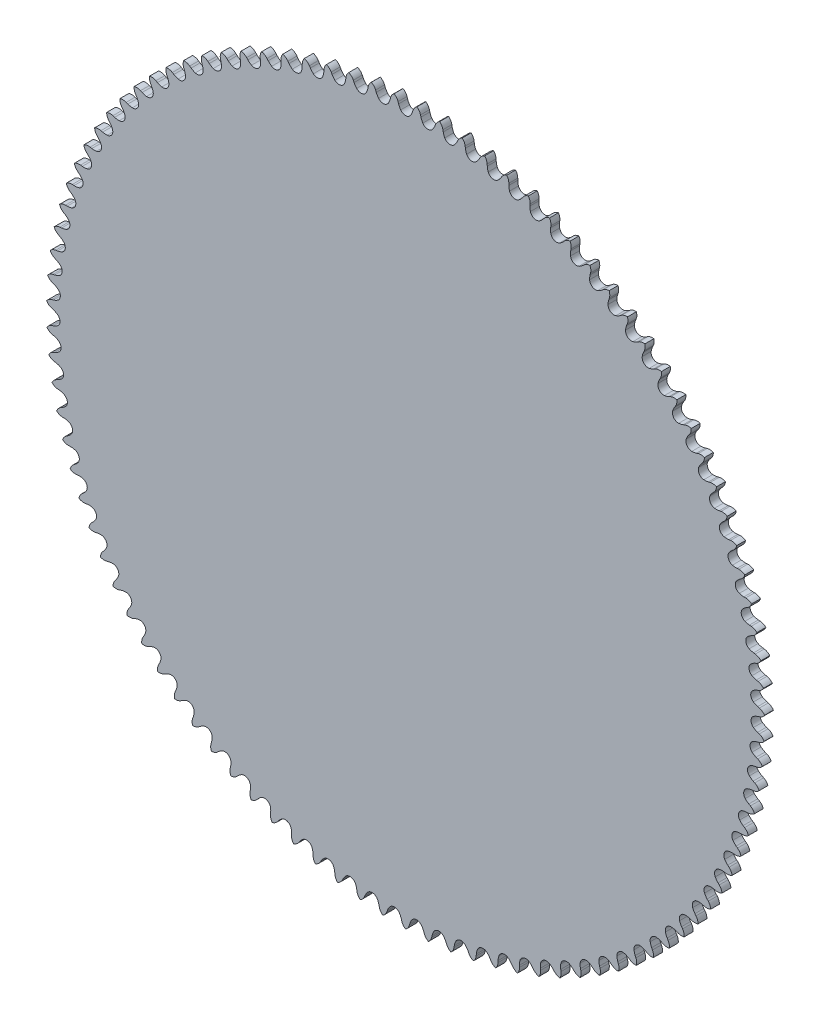
from build123d import *

# Parameters (mm, degrees)
BOSS_EXTRUDE1_DEPTH = 2.54


with BuildPart() as part:
    # Sketch1 → Boss-Extrude1 (new body)
    with BuildSketch(Plane.XY):
        with BuildLine():
            ThreePointArc((-1.380016119, 99.081333816), (-1.722125671, 99.64516894), (-1.974830149, 100.254340047))
            Line((-1.974830149, 100.254340047), (-2.133929911, 100.739050993))
            ThreePointArc((-2.133929911, 100.739050993), (-2.563862198, 101.541329529), (-3.242572124, 102.147832173))
            ThreePointArc((-3.242572124, 102.147832173), (-3.881448811, 101.499504171), (-4.259631857, 100.671572891))
            Line((-4.259631857, 100.671572891), (-4.387669031, 100.177747094))
            ThreePointArc((-4.387669031, 100.177747094), (-4.601228714, 99.553774937), (-4.906888855, 98.969377067))
            ThreePointArc((-4.906888855, 98.969377067), (-6.239150137, 98.174139078), (-7.661364256, 98.794325004))
            ThreePointArc((-7.661364256, 98.794325004), (-8.038545664, 99.335327016), (-8.329377385, 99.927244157))
            Line((-8.329377385, 99.927244157), (-8.518899096, 100.400888492))
            ThreePointArc((-8.518899096, 100.400888492), (-8.99884944, 101.174283791), (-9.714659678, 101.736518905))
            ThreePointArc((-9.714659678, 101.736518905), (-10.311130597, 101.048976133), (-10.636041591, 100.198725896))
            Line((-10.636041591, 100.198725896), (-10.732500617, 99.697773711))
            ThreePointArc((-10.732500617, 99.697773711), (-10.906055575, 99.061513019), (-11.17403552, 98.458905567))
            ThreePointArc((-11.17403552, 98.458905567), (-12.453177418, 97.580771417), (-13.911862782, 98.109506314))
            ThreePointArc((-13.911862782, 98.109506314), (-14.32259727, 98.625496791), (-14.650385159, 99.197776523))
            Line((-14.650385159, 99.197776523), (-14.869565681, 99.65844705))
            ThreePointArc((-14.869565681, 99.65844705), (-15.397601491, 100.399844921), (-16.147629726, 100.915548583))
            ThreePointArc((-16.147629726, 100.915548583), (-16.699293099, 100.191559534), (-16.969623739, 99.322413996))
            Line((-16.969623739, 99.322413996), (-17.034116211, 98.816352581))
            ThreePointArc((-17.034116211, 98.816352581), (-17.1669676, 98.170365352), (-17.396188288, 97.551974805))
            ThreePointArc((-17.396188288, 97.551974805), (-18.61706015, 96.59448043), (-20.106343148, 97.02963527))
            ThreePointArc((-20.106343148, 97.02963527), (-20.548976833, 97.518536499), (-20.912401002, 98.068874454))
            Line((-20.912401002, 98.068874454), (-21.160357774, 98.514716214))
            ThreePointArc((-21.160357774, 98.514716214), (-21.734352836, 99.221131311), (-22.515578969, 99.688226964))
            ThreePointArc((-22.515578969, 99.688226964), (-23.020213441, 98.930706886), (-23.234875201, 98.046165791))
            Line((-23.234875201, 98.046165791), (-23.267141431, 97.537032875))
            ThreePointArc((-23.267141431, 97.537032875), (-23.358754305, 96.883920271), (-23.548292745, 96.252236671))
            ThreePointArc((-23.548292745, 96.252236671), (-24.705978551, 95.219237562), (-26.219862366, 95.55906013))
            ThreePointArc((-26.219862366, 95.55906013), (-26.692612918, 96.01890348), (-27.090209987, 96.545083641))
            Line((-27.090209987, 96.545083641), (-27.365944574, 96.974301387))
            ThreePointArc((-27.365944574, 96.974301387), (-27.983587612, 97.642889225), (-28.792865922, 98.05949604))
            ThreePointArc((-28.792865922, 98.05949604), (-29.248439509, 97.271495198), (-29.406568022, 96.37512028))
            Line((-29.406568022, 96.37512028), (-29.406478084, 95.864965963))
            ThreePointArc((-29.406478084, 95.864965963), (-29.456483551, 95.207357839), (-29.605576538, 94.564924751))
            ThreePointArc((-29.605576538, 94.564924751), (-30.695414696, 93.460580432), (-32.227803452, 93.703702382))
            ThreePointArc((-32.227803452, 93.703702382), (-32.728767272, 94.132636225), (-33.158936258, 94.632539851))
            Line((-33.158936258, 94.632539851), (-33.461338373, 95.043405274))
            ThreePointArc((-33.461338373, 95.043405274), (-34.120142358, 95.671473686), (-34.954214166, 96.035914135))
            ThreePointArc((-34.954214166, 96.035914135), (-35.358892434, 95.220605531), (-35.459850973, 94.316006175))
            Line((-35.459850973, 94.316006175), (-35.427405229, 93.806884668))
            ThreePointArc((-35.427405229, 93.806884668), (-35.435601933, 93.147428979), (-35.543649124, 92.496833255))
            ThreePointArc((-35.543649124, 92.496833255), (-36.561251239, 91.325590531), (-38.105974548, 91.471032896))
            ThreePointArc((-38.105974548, 91.471032896), (-38.633134432, 91.867330068), (-39.094143196, 92.338944223))
            Line((-39.094143196, 92.338944223), (-39.421995174, 92.729802914))
            ThreePointArc((-39.421995174, 92.729802914), (-40.119307333, 93.314822889), (-40.974814126, 93.625629498))
            ThreePointArc((-40.974814126, 93.625629498), (-41.326967579, 92.786296092), (-41.370349618, 91.877114802))
            Line((-41.370349618, 91.877114802), (-41.305678717, 91.371076157))
            ThreePointArc((-41.305678717, 91.371076157), (-41.272033654, 90.712428299), (-41.33859998, 90.056289658))
            ThreePointArc((-41.33859998, 90.056289658), (-42.279868528, 88.82286471), (-43.830706334, 88.870041845))
            ThreePointArc((-43.830706334, 88.870041845), (-44.381939595, 89.232106596), (-44.871931817, 89.673532257))
            Line((-44.871931817, 89.673532257), (-45.223913513, 90.042810365))
            ThreePointArc((-45.223913513, 90.042810365), (-45.956926018, 90.582426236), (-46.830422972, 90.838347496))
            ThreePointArc((-46.830422972, 90.838347496), (-47.128633611, 89.978368988), (-47.114264467, 89.068266715))
            Line((-47.114264467, 89.068266715), (-47.017628815, 88.567348572))
            ThreePointArc((-47.017628815, 88.567348572), (-46.942277462, 87.912160686), (-46.967094884, 87.253121168))
            ThreePointArc((-46.967094884, 87.253121168), (-47.828239709, 85.962480562), (-49.378947336, 85.911202502))
            ThreePointArc((-49.378947336, 85.911202502), (-49.952034351, 86.237576926), (-50.469037006, 86.647036626))
            Line((-50.469037006, 86.647036626), (-50.843731114, 86.993247199))
            ThreePointArc((-50.843731114, 86.993247199), (-51.609492381, 87.485286123), (-52.497462233, 87.68529153))
            ThreePointArc((-52.497462233, 87.68529153), (-52.74052927, 86.808130749), (-52.668466802, 85.900772153))
            Line((-52.668466802, 85.900772153), (-52.540255517, 85.406991532))
            ThreePointArc((-52.540255517, 85.406991532), (-52.423501287, 84.75790183), (-52.406469874, 84.098615153))
            ThreePointArc((-52.406469874, 84.098615153), (-53.18402345, 82.755955845), (-54.728356745, 82.606429068))
            ThreePointArc((-54.728356745, 82.606429068), (-55.320989896, 82.89579897), (-55.862921196, 83.27164396))
            Line((-55.862921196, 83.27164396), (-56.258818955, 83.593392931))
            ThreePointArc((-56.258818955, 83.593392931), (-57.054245534, 84.035873639), (-57.953112742, 84.179157843))
            ThreePointArc((-57.953112742, 84.179157843), (-58.140057431, 83.288346806), (-58.01059181, 82.387385501))
            Line((-58.01059181, 82.387385501), (-57.851321153, 81.902730682))
            ThreePointArc((-57.851321153, 81.902730682), (-57.693634174, 81.262352819), (-57.634822506, 80.605473698))
            ThreePointArc((-57.634822506, 80.605473698), (-58.325653899, 79.216202102), (-59.857394377, 78.9690287))
            ThreePointArc((-59.857394377, 78.9690287), (-60.467187339, 79.220228889), (-61.031865119, 79.560945775))
            Line((-61.031865119, 79.560945775), (-61.447372388, 79.856937573))
            ThreePointArc((-61.447372388, 79.856937573), (-62.269261377, 80.248078353), (-63.17540652, 80.334064397))
            ThreePointArc((-63.17540652, 80.334064397), (-63.305476102, 79.433190086), (-63.11912864, 78.542253925))
            Line((-63.11912864, 78.542253925), (-62.929439938, 78.068676443))
            ThreePointArc((-62.929439938, 78.068676443), (-62.731455159, 77.439588993), (-62.631100049, 76.787762449))
            ThreePointArc((-62.631100049, 76.787762449), (-63.232427525, 75.357472671), (-64.745407408, 75.013647924))
            ThreePointArc((-64.745407408, 75.013647924), (-65.36990476, 75.225666906), (-65.955055261, 75.529883741))
            Line((-65.955055261, 75.529883741), (-66.38849894, 75.798926512))
            ThreePointArc((-66.38849894, 75.798926512), (-67.233540882, 76.137152378), (-68.143315234, 76.165494028))
            ThreePointArc((-68.143315234, 76.165494028), (-68.215985964, 75.258183946), (-67.973507016, 74.380860414))
            Line((-67.973507016, 74.380860414), (-67.754164078, 73.920267197))
            ThreePointArc((-67.754164078, 73.920267197), (-67.516678715, 73.305003275), (-67.375184258, 72.660853983))
            ThreePointArc((-67.375184258, 72.660853983), (-67.884586483, 71.195305295), (-69.372713535, 70.756213665))
            ThreePointArc((-69.372713535, 70.756213665), (-70.009400647, 70.928197714), (-70.612667675, 71.194689523))
            Line((-70.612667675, 71.194689523), (-71.062302438, 71.435699927))
            ThreePointArc((-71.062302438, 71.435699927), (-71.927094648, 71.719648963), (-72.836834868, 71.690232096))
            ThreePointArc((-72.836834868, 71.690232096), (-72.851814126, 70.78013966), (-72.55418007, 69.91996143))
            Line((-72.55418007, 69.91996143), (-72.306066113, 69.474207125))
            ThreePointArc((-72.306066113, 69.474207125), (-72.030036435, 68.875244181), (-71.847972379, 68.241365903))
            ThreePointArc((-71.847972379, 68.241365903), (-72.263398171, 66.746459553), (-73.720680229, 66.213869105))
            ThreePointArc((-73.720680229, 66.213869105), (-74.366993386, 66.345125703), (-74.985947798, 66.572819418))
            Line((-74.985947798, 66.572819418), (-75.449963126, 66.784826991))
            ThreePointArc((-75.449963126, 66.784826991), (-76.331023389, 67.013355834), (-77.237066275, 66.926298903))
            ThreePointArc((-77.237066275, 66.926298903), (-77.194293746, 66.017088734), (-76.842703048, 65.177519439))
            Line((-76.842703048, 65.177519439), (-76.56681714, 64.748398941))
            ThreePointArc((-76.56681714, 64.748398941), (-76.253354622, 64.168148787), (-76.031454074, 63.547093928))
            ThreePointArc((-76.031454074, 63.547093928), (-76.351230659, 62.028849376), (-77.771799763, 61.404904665))
            ThreePointArc((-77.771799763, 61.404904665), (-78.425136491, 61.494905287), (-79.057285975, 61.682884066))
            Line((-79.057285975, 61.682884066), (-79.533813441, 61.865035128))
            ThreePointArc((-79.533813441, 61.865035128), (-80.42759404, 62.037223573), (-81.326291277, 61.892877124))
            ThreePointArc((-81.326291277, 61.892877124), (-81.22593919, 60.988210291), (-80.821807582, 60.172630581))
            Line((-80.821807582, 60.172630581), (-80.519260618, 59.761871808))
            ThreePointArc((-80.519260618, 59.761871808), (-80.169627462, 59.202670907), (-79.908783939, 58.596940234))
            ThreePointArc((-79.908783939, 58.596940234), (-80.131623689, 57.061470915), (-81.509759709, 56.348684346))
            ThreePointArc((-81.509759709, 56.348684346), (-82.167489251, 56.397066591), (-82.810288364, 56.54457351))
            Line((-82.810288364, 56.54457351), (-83.297409161, 56.696134604))
            ThreePointArc((-83.297409161, 56.696134604), (-84.200311157, 56.811289309), (-85.088044007, 56.610234575))
            ThreePointArc((-85.088044007, 56.610234575), (-84.930516445, 55.713753851), (-84.475471223, 54.925447777))
            Line((-84.475471223, 54.925447777), (-84.147481452, 54.534704709))
            ThreePointArc((-84.147481452, 54.534704709), (-83.763085508, 53.998804765), (-83.464349333, 53.410837343))
            ThreePointArc((-83.464349333, 53.410837343), (-83.589354953, 51.86432605), (-84.919508621, 51.065567763))
            ThreePointArc((-84.919508621, 51.065567763), (-85.578982532, 51.072136813), (-86.22984295, 51.178577914))
            Line((-86.22984295, 51.178577914), (-86.725595613, 51.298938756))
            ThreePointArc((-86.725595613, 51.298938756), (-87.633983338, 51.356596034), (-88.507177216, 51.099642591))
            ThreePointArc((-88.507177216, 51.099642591), (-88.293108486, 50.214957789), (-87.788981956, 49.457099581))
            Line((-87.788981956, 49.457099581), (-87.436870078, 49.087945602))
            ThreePointArc((-87.436870078, 49.087945602), (-87.019259172, 48.577504496), (-86.683833252, 48.009667861))
            ThreePointArc((-86.683833252, 48.009667861), (-86.710501386, 46.45834185), (-87.987316643, 45.576828162))
            ThreePointArc((-87.987316643, 45.576828162), (-88.645879455, 45.541557566), (-89.302180392, 45.606504248))
            Line((-89.302180392, 45.606504248), (-89.804568701, 45.695180187))
            ThreePointArc((-89.804568701, 45.695180187), (-90.714784398, 45.695107872), (-91.56992326, 45.383290381))
            ThreePointArc((-91.56992326, 45.383290381), (-91.300175341, 44.513963814), (-90.748997443, 43.789605101))
            Line((-90.748997443, 43.789605101), (-90.374181288, 43.443526663))
            ThreePointArc((-90.374181288, 43.443526663), (-89.925036992, 42.960599761), (-89.554271968, 42.415180392))
            ThreePointArc((-89.554271968, 42.415180392), (-89.482495234, 40.865286304), (-90.700830796, 39.90456676))
            ThreePointArc((-90.700830796, 39.90456676), (-91.355830708, 39.827598541), (-92.014929472, 39.850789285))
            Line((-92.014929472, 39.850789285), (-92.521930487, 39.907423255))
            ThreePointArc((-92.521930487, 39.907423255), (-93.430309039, 39.849621639), (-94.263949541, 39.484195679))
            ThreePointArc((-94.263949541, 39.484195679), (-93.939608615, 38.633727818), (-93.343598747, 37.945785336))
            Line((-93.343598747, 37.945785336), (-92.947587567, 37.624175976))
            ThreePointArc((-92.947587567, 37.624175976), (-92.468718427, 37.170707853), (-92.064107238, 36.649901961))
            ThreePointArc((-92.064107238, 36.649901961), (-91.894174657, 35.107680673), (-93.049124715, 34.071623751))
            ThreePointArc((-93.049124715, 34.071623751), (-93.697924274, 33.953267832), (-94.357166908, 33.93460926))
            Line((-94.357166908, 33.93460926), (-94.866739113, 33.958973216))
            ThreePointArc((-94.866739113, 33.958973216), (-95.7696228, 33.843675044), (-96.578408168, 33.426112057))
            ThreePointArc((-96.578408168, 33.426112057), (-96.20078024, 32.597927435), (-95.562338324, 31.949171286))
            Line((-95.562338324, 31.949171286), (-95.146726717, 31.653326011))
            ThreePointArc((-95.146726717, 31.653326011), (-94.640060969, 31.231142624), (-94.203232843, 30.73704731))
            ThreePointArc((-94.203232843, 30.73704731), (-93.935828671, 29.208708803), (-95.022742651, 28.10148634))
            ThreePointArc((-95.022742651, 28.10148634), (-95.66272937, 27.942219298), (-96.319461335, 27.881786539))
            Line((-96.319461335, 27.881786539), (-96.829552864, 27.873782376))
            ThreePointArc((-96.829552864, 27.873782376), (-97.723306092, 27.701451915), (-98.503979633, 27.233433279))
            ThreePointArc((-98.503979633, 27.233433279), (-98.074585276, 26.430866704), (-97.396282093, 25.8239092))
            Line((-97.396282093, 25.8239092), (-96.962743579, 25.555019274))
            ThreePointArc((-96.962743579, 25.555019274), (-96.430321388, 25.165820607), (-95.963035277, 24.700425418))
            ThreePointArc((-95.963035277, 24.700425418), (-95.599236258, 23.192123772), (-96.613737539, 22.01819416))
            ThreePointArc((-96.613737539, 22.01819416), (-97.242334418, 21.818657309), (-97.893911286, 21.716693705))
            Line((-97.893911286, 21.716693705), (-98.402468181, 21.676353653))
            ThreePointArc((-98.402468181, 21.676353653), (-99.283492122, 21.447684816), (-100.032910337, 20.931095077))
            ThreePointArc((-100.032910337, 20.931095077), (-99.553478572, 20.157378201), (-98.838045409, 19.594663345))
            Line((-98.838045409, 19.594663345), (-98.388325695, 19.353811494))
            ThreePointArc((-98.388325695, 19.353811494), (-97.832290938, 18.999164712), (-97.336428437, 18.564343631))
            ThreePointArc((-97.336428437, 18.564343631), (-96.877699461, 17.082152244), (-97.815703005, 15.846242485))
            ThreePointArc((-97.815703005, 15.846242485), (-98.430378906, 15.607239287), (-99.074177008, 15.464155411))
            Line((-99.074177008, 15.464155411), (-99.579151489, 15.391641904))
            ThreePointArc((-99.579151489, 15.391641904), (-100.443898569, 15.10755546), (-101.159043817, 14.544474742))
            ThreePointArc((-101.159043817, 14.544474742), (-100.631505147, 13.802723051), (-99.8818228, 13.286516698))
            Line((-99.8818228, 13.286516698), (-99.417732749, 13.074672746))
            ThreePointArc((-99.417732749, 13.074672746), (-98.840324381, 12.756005886), (-98.317882154, 12.353509785))
            ThreePointArc((-98.317882154, 12.353509785), (-97.766070361, 10.903396918), (-98.623799159, 9.610483583))
            ThreePointArc((-98.623799159, 9.610483583), (-99.222078999, 9.332976422), (-99.855505987, 9.14934842))
            Line((-99.855505987, 9.14934842), (-100.3548647, 9.044953446))
            ThreePointArc((-100.3548647, 9.044953446), (-101.199852889, 8.70659331), (-101.877845532, 8.099288941))
            ThreePointArc((-101.877845532, 8.099288941), (-101.304324168, 7.392489206), (-100.523411344, 6.924869937))
            Line((-100.523411344, 6.924869937), (-100.046819683, 6.742886905))
            ThreePointArc((-100.046819683, 6.742886905), (-99.450362723, 6.461483127), (-98.903444461, 6.092932714))
            ThreePointArc((-98.903444461, 6.092932714), (-98.260771801, 4.680737461), (-99.034772083, 3.336026657))
            ThreePointArc((-99.034772083, 3.336026657), (-99.6142468, 3.021132954), (-100.234752086, 2.797700233))
            Line((-100.234752086, 2.797700233), (-100.726484291, 2.661844152))
            ThreePointArc((-100.726484291, 2.661844152), (-101.548311119, 2.270572782), (-102.18642112, 1.621490163))
            ThreePointArc((-102.18642112, 1.621490163), (-101.56922643, 0.952488417), (-100.760227589, 0.535339168))
            Line((-100.760227589, 0.535339168), (-100.273053384, 0.383949839))
            ThreePointArc((-100.273053384, 0.383949839), (-99.659949554, 0.140942256), (-99.090757504, -0.192178446))
            ThreePointArc((-99.090757504, -0.192178446), (-98.359811794, -1.560769674), (-99.046966933, -2.951863272))
            ThreePointArc((-99.046966933, -2.951863272), (-99.605303187, -3.30287555), (-100.210388216, -3.565213306))
            Line((-100.210388216, -3.565213306), (-100.69251388, -3.731983448))
            ThreePointArc((-100.69251388, -3.731983448), (-101.48787014, -4.174590541), (-102.083528056, -4.862837785))
            ThreePointArc((-102.083528056, -4.862837785), (-101.425145266, -5.491347707), (-100.591317961, -5.856347222))
            Line((-100.591317961, -5.856347222), (-100.09552289, -5.976533258))
            ThreePointArc((-100.09552289, -5.976533258), (-99.468240943, -6.18016614), (-98.879067041, -6.476515771))
            ThreePointArc((-98.879067041, -6.476515771), (-98.06279154, -7.795992141), (-98.660334605, -9.227867089))
            ThreePointArc((-98.660334605, -9.227867089), (-99.195284173, -9.613584539), (-99.782512482, -9.913770989))
            Line((-99.782512482, -9.913770989), (-100.253090254, -10.110783668))
            ThreePointArc((-100.253090254, -10.110783668), (-101.018773328, -10.602944262), (-101.569580654, -11.327584801))
            ThreePointArc((-101.569580654, -11.327584801), (-100.872660839, -11.913072112), (-100.017362598, -12.224452169))
            Line((-100.017362598, -12.224452169), (-99.514943054, -12.312950964))
            ThreePointArc((-99.514943054, -12.312950964), (-98.876008833, -12.476389188), (-98.269225472, -12.734774453))
            ThreePointArc((-98.269225472, -12.734774453), (-97.370907035, -13.999822898), (-97.876431931, -15.466713543))
            ThreePointArc((-97.876431931, -15.466713543), (-98.38584076, -15.885583017), (-98.952847787, -16.222409416))
            Line((-98.952847787, -16.222409416), (-99.409982818, -16.448871331))
            ThreePointArc((-99.409982818, -16.448871331), (-100.14290957, -16.988603668), (-100.646648399, -17.746719631))
            ThreePointArc((-100.646648399, -17.746719631), (-99.913997809, -18.28682678), (-99.040672616, -18.543333561))
            Line((-99.040672616, -18.543333561), (-98.533651665, -18.599788763))
            ThreePointArc((-98.533651665, -18.599788763), (-97.885637932, -18.72237422), (-97.263688417, -18.941754693))
            ThreePointArc((-97.263688417, -18.941754693), (-96.286944255, -20.14728131), (-96.698415411, -21.643281))
            ThreePointArc((-96.698415411, -21.643281), (-97.180232291, -22.093615859), (-97.724734899, -22.465725925))
            Line((-97.724734899, -22.465725925), (-98.166586467, -22.720725195))
            ThreePointArc((-98.166586467, -22.720725195), (-98.86380566, -23.305855963), (-99.318447614, -24.094394684))
            ThreePointArc((-99.318447614, -24.094394684), (-98.553016374, -24.586946851), (-97.665180802, -24.787547494))
            Line((-97.665180802, -24.787547494), (-97.155600037, -24.811731778))
            ThreePointArc((-97.155600037, -24.811731778), (-96.501116116, -24.892970859), (-95.866504817, -25.072463173))
            ThreePointArc((-95.866504817, -25.072463173), (-94.815267933, -26.213613731), (-95.1310285, -27.732698603))
            ThreePointArc((-95.1310285, -27.732698603), (-95.583313326, -28.212685507), (-96.103118995, -28.618580885))
            Line((-96.103118995, -28.618580885), (-96.527907919, -28.901090717))
            ThreePointArc((-96.527907919, -28.901090717), (-97.186612098, -29.529263802), (-97.590326494, -30.345050114))
            ThreePointArc((-97.590326494, -30.345050114), (-96.795196725, -30.788063965), (-95.896425775, -30.931950722))
            Line((-95.896425775, -30.931950722), (-95.386337099, -30.923766705))
            ThreePointArc((-95.386337099, -30.923766705), (-94.728018365, -30.963332291), (-94.083300637, -31.102213692))
            ThreePointArc((-94.083300637, -31.102213692), (-92.961803992, -32.174393181), (-93.180582514, -33.710446416))
            ThreePointArc((-93.180582514, -33.710446416), (-93.601514093, -34.218152628), (-94.09452975, -34.656198921))
            Line((-94.09452975, -34.656198921), (-94.500545555, -34.965081748))
            ThreePointArc((-94.500545555, -34.965081748), (-95.11808235, -35.633767718), (-95.469243573, -36.473516738))
            ThreePointArc((-95.469243573, -36.473516738), (-94.647616983, -36.865208411), (-93.741529687, -36.951801902))
            Line((-93.741529687, -36.951801902), (-93.232987047, -36.911282539))
            ThreePointArc((-93.232987047, -36.911282539), (-92.573484317, -36.909015311), (-91.921256212, -37.006726574))
            ThreePointArc((-91.921256212, -37.006726574), (-90.734015677, -38.005617706), (-90.85493121, -39.55245416))
            ThreePointArc((-90.85493121, -39.55245416), (-91.2428146, -40.085835326), (-91.707055043, -40.554268675))
            Line((-91.707055043, -40.554268675), (-92.092662848, -40.888280735))
            ThreePointArc((-92.092662848, -40.888280735), (-92.666545656, -41.594787028), (-92.963739703, -42.455117382))
            ThreePointArc((-92.963739703, -42.455117382), (-92.118924693, -42.793909675), (-91.209169545, -42.822861217))
            Line((-91.209169545, -42.822861217), (-90.704220663, -42.750169665))
            ThreePointArc((-90.704220663, -42.750169665), (-90.046189521, -42.706078754), (-89.389077331, -42.762226429))
            ThreePointArc((-89.389077331, -42.762226429), (-88.140873504, -43.683807022), (-88.163439165, -45.235198131))
            ThreePointArc((-88.163439165, -45.235198131), (-88.516712495, -45.792106513), (-88.950308393, -46.289040703))
            Line((-88.950308393, -46.289040703), (-89.313955491, -46.646837047))
            ThreePointArc((-89.313955491, -46.646837047), (-89.841873489, -47.388318811), (-90.083903665, -48.265766254))
            ThreePointArc((-90.083903665, -48.265766254), (-89.219302005, -48.550294969), (-88.309542269, -48.521487984))
            Line((-88.309542269, -48.521487984), (-87.810220395, -48.416916946))
            ThreePointArc((-87.810220395, -48.416916946), (-87.156310502, -48.33117989), (-86.496960185, -48.345537892))
            ThreePointArc((-86.496960185, -48.345537892), (-85.192819143, -49.186097065), (-85.116944066, -50.735795925))
            ThreePointArc((-85.116944066, -50.735795925), (-85.434184831, -51.313989049), (-85.835390246, -51.837423101))
            Line((-85.835390246, -51.837423101), (-86.175612358, -52.217563009))
            ThreePointArc((-86.175612358, -52.217563009), (-86.655439807, -52.99103456), (-86.841331541, -53.882065919))
            ThreePointArc((-86.841331541, -53.882065919), (-85.960424678, -54.11118536), (-85.054323634, -54.024735844))
            Line((-85.054323634, -54.024735844), (-84.562639362, -53.888706392))
            ThreePointArc((-84.562639362, -53.888706392), (-83.915483781, -53.761668424), (-83.256550309, -53.734178936))
            ThreePointArc((-83.256550309, -53.734178936), (-81.901723367, -54.490332056), (-81.727713076, -56.032098575))
            ThreePointArc((-81.727713076, -56.032098575), (-82.007643858, -56.629248262), (-82.374843277, -57.177074492))
            Line((-82.374843277, -57.177074492), (-82.690270449, -57.578027276))
            ThreePointArc((-82.690270449, -57.578027276), (-83.120075252, -58.380374115), (-83.249080025, -59.281401523))
            ThreePointArc((-83.249080025, -59.281401523), (-82.355415059, -59.454189105), (-81.456621257, -59.310445161))
            Line((-81.456621257, -59.310445161), (-80.974554426, -59.143505036))
            ThreePointArc((-80.974554426, -59.143505036), (-80.336759024, -58.975677693), (-79.68089569, -58.906451407))
            ThreePointArc((-79.68089569, -58.906451407), (-78.280838258, -59.575153711), (-78.00939343, -61.102779741))
            ThreePointArc((-78.00939343, -61.102779741), (-78.250887047, -61.71648148), (-78.582601888, -62.286493984))
            Line((-78.582601888, -62.286493984), (-78.871964006, -62.706645148))
            ThreePointArc((-78.871964006, -62.706645148), (-79.250015492, -63.534636509), (-79.321613847, -64.442031845))
            ThreePointArc((-79.321613847, -64.442031845), (-78.418789252, -64.557791816), (-77.530921817, -64.357332249))
            Line((-77.530921817, -64.357332249), (-77.060413539, -64.16015366))
            ThreePointArc((-77.060413539, -64.16015366), (-76.434546493, -63.952212723), (-75.784394227, -63.841528389))
            ThreePointArc((-75.784394227, -63.841528389), (-74.344743843, -64.420087248), (-73.97695749, -65.927421578))
            ThreePointArc((-73.97695749, -65.927421578), (-74.179041532, -66.555204209), (-74.473936097, -67.145107749))
            Line((-74.473936097, -67.145107749), (-74.736068001, -67.582765492))
            ThreePointArc((-74.736068001, -67.582765492), (-75.06084389, -68.433067346), (-75.074747525, -69.34317685))
            ThreePointArc((-75.074747525, -69.34317685), (-74.166398657, -69.401443084), (-73.293032718, -69.145075074))
            Line((-73.293032718, -69.145075074), (-72.835977564, -68.91845199))
            ThreePointArc((-72.835977564, -68.91845199), (-72.224559021, -68.671234764), (-71.582735756, -68.519538068))
            ThreePointArc((-71.582735756, -68.519538068), (-70.109289383, -69.005623831), (-69.646642451, -70.486596957))
            ThreePointArc((-69.646642451, -70.486596957), (-69.808503198, -71.12593262), (-70.06539005, -71.733351863))
            Line((-70.06539005, -71.733351863), (-70.299236229, -72.186753893))
            ThreePointArc((-70.299236229, -72.186753893), (-70.569428761, -73.055942374), (-70.525581692, -73.965101356))
            ThreePointArc((-70.525581692, -73.965101356), (-69.615366151, -73.965639235), (-68.760018444, -73.654395086))
            Line((-68.760018444, -73.654395086), (-68.318256815, -73.399240038))
            ThreePointArc((-68.318256815, -73.399240038), (-67.72374874, -73.11374198), (-67.092838872, -72.921643751))
            ThreePointArc((-67.092838872, -72.921643751), (-65.591529559, -73.313299122), (-65.035884965, -74.761947688))
            ThreePointArc((-65.035884965, -74.761947688), (-65.15687066, -75.410262005), (-65.374715406, -76.032751088))
            Line((-65.374715406, -76.032751088), (-65.579334243, -76.500071713))
            ThreePointArc((-65.579334243, -76.500071713), (-65.79385545, -77.384646906), (-65.692434233, -78.289194504))
            ThreePointArc((-65.692434233, -78.289194504), (-64.784017136, -78.232001863), (-63.950131845, -77.867134844))
            Line((-63.950131845, -77.867134844), (-63.525442558, -77.584475253))
            ThreePointArc((-63.525442558, -77.584475253), (-62.950238827, -77.261845962), (-62.332782807, -77.030119713))
            ThreePointArc((-62.332782807, -77.030119713), (-60.809655796, -77.325767633), (-60.163250924, -78.736258443))
            ThreePointArc((-60.163250924, -78.736258443), (-60.2428744, -79.39094088), (-60.420799858, -80.025993258))
            Line((-60.420799858, -80.025993258), (-60.595367424, -80.505350745))
            ThreePointArc((-60.595367424, -80.505350745), (-60.753353505, -81.401750778), (-60.594766528, -82.298044698))
            ThreePointArc((-60.594766528, -82.298044698), (-59.69180575, -82.183351831), (-58.882740636, -81.766331134))
            Line((-58.882740636, -81.766331134), (-58.476833765, -81.457305168))
            ThreePointArc((-58.476833765, -81.457305168), (-57.923250519, -81.09884376), (-57.321734625, -80.828422569))
            ThreePointArc((-57.321734625, -80.828422569), (-55.782923012, -81.026872569), (-55.048360706, -82.393526074))
            ThreePointArc((-55.048360706, -82.393526074), (-55.086301348, -83.051940457), (-55.223591073, -83.696998999))
            Line((-55.223591073, -83.696998999), (-55.367404448, -84.186463143))
            ThreePointArc((-55.367404448, -84.186463143), (-55.468219248, -85.091078529), (-55.253105084, -85.975509712))
            ThreePointArc((-55.253105084, -85.975509712), (-54.359236529, -85.803778447), (-53.578249412, -85.336283267))
            Line((-53.578249412, -85.336283267), (-53.192759401, -85.002135266))
            ThreePointArc((-53.192759401, -85.002135266), (-52.663025725, -84.609285137), (-52.079872049, -84.301257895))
            ThreePointArc((-52.079872049, -84.301257895), (-50.531572084, -84.401710888), (-49.711810168, -85.719024056))
            ThreePointArc((-49.711810168, -85.719024056), (-49.707915203, -86.378519182), (-49.804016378, -87.030986465))
            Line((-49.804016378, -87.030986465), (-49.916496475, -87.528586368))
            ThreePointArc((-49.916496475, -87.528586368), (-49.959734049, -88.43777454), (-49.688958887, -89.306781693))
            ThreePointArc((-49.688958887, -89.306781693), (-48.807781849, -89.078703531), (-48.058017488, -88.562616306))
            Line((-48.058017488, -88.562616306), (-47.694496569, -88.204691765))
            ThreePointArc((-47.694496569, -88.204691765), (-47.190745513, -87.779034785), (-46.628302209, -87.43464181))
            ThreePointArc((-46.628302209, -87.43464181), (-45.076748351, -87.436693305), (-44.175087717, -88.699361782))
            ThreePointArc((-44.175087717, -88.699361782), (-44.129372827, -89.357282097), (-44.183898486, -90.014530866))
            Line((-44.183898486, -90.014530866), (-44.264592389, -90.518262867))
            ThreePointArc((-44.264592389, -90.518262867), (-44.250078634, -91.428362846), (-43.92473279, -92.278446784))
            ThreePointArc((-43.92473279, -92.278446784), (-43.059795457, -91.994940116), (-42.34427289, -91.432338947))
            Line((-42.34427289, -91.432338947), (-42.004184833, -91.052079103))
            ThreePointArc((-42.004184833, -91.052079103), (-41.528444825, -90.595329241), (-40.988976654, -90.215957281))
            ThreePointArc((-40.988976654, -90.215957281), (-39.440416462, -90.119599019), (-38.460487778, -91.322538484))
            ThreePointArc((-38.460487778, -91.322538484), (-38.373137042, -91.976234775), (-38.38586763, -92.63561852))
            Line((-38.38586763, -92.63561852), (-38.434450412, -93.14345427))
            ThreePointArc((-38.434450412, -93.14345427), (-38.36224377, -94.050801404), (-37.983637297, -94.87853914))
            ThreePointArc((-37.983637297, -94.87853914), (-37.138422467, -94.540745546), (-36.46002285, -93.933895829))
            Line((-36.46002285, -93.933895829), (-36.14473707, -93.532831854))
            ThreePointArc((-36.14473707, -93.532831854), (-35.698923747, -93.046828281), (-35.184602956, -92.634004934))
            ThreePointArc((-35.184602956, -92.634004934), (-33.645271936, -92.439624915), (-32.591021029, -93.577991556))
            ThreePointArc((-32.591021029, -93.577991556), (-32.462386178, -94.224831618), (-32.433270434, -94.883695235))
            Line((-32.433270434, -94.883695235), (-32.449546469, -95.393589857))
            ThreePointArc((-32.449546469, -95.393589857), (-32.31993769, -96.294530579), (-31.889595103, -97.096589105))
            ThreePointArc((-31.889595103, -97.096589105), (-31.067506158, -96.705868762), (-30.428961166, -96.057214067))
            Line((-30.428961166, -96.057214067), (-30.139747208, -95.636960902))
            ThreePointArc((-30.139747208, -95.636960902), (-29.725655703, -95.123660584), (-29.238553281, -94.679048144))
            ThreePointArc((-29.238553281, -94.679048144), (-27.714649775, -94.387429067), (-26.590321742, -95.456639083))
            ThreePointArc((-26.590321742, -95.456639083), (-26.420920741, -96.094018321), (-26.350075904, -96.749708797))
            Line((-26.350075904, -96.749708797), (-26.333979654, -97.259609126))
            ThreePointArc((-26.333979654, -97.259609126), (-26.147490628, -98.150515667), (-25.667144765, -98.923665375))
            ThreePointArc((-25.667144765, -98.923665375), (-24.871491966, -98.481591575), (-24.275372795, -97.793743806))
            Line((-24.275372795, -97.793743806), (-24.013395221, -97.355993664))
            ThreePointArc((-24.013395221, -97.355993664), (-23.632692935, -96.817463479), (-23.174770271, -96.342852242))
            ThreePointArc((-23.174770271, -96.342852242), (-21.6724305, -95.955168356), (-20.482552613, -96.950916415))
            ThreePointArc((-20.482552613, -96.950916415), (-20.273067583, -97.576268327), (-20.160778919, -98.226145429))
            Line((-20.160778919, -98.226145429), (-20.112375199, -98.733998277))
            ThreePointArc((-20.112375199, -98.733998277), (-19.86975685, -99.611283269), (-19.341341893, -100.352410959))
            ThreePointArc((-19.341341893, -100.352410959), (-18.575329054, -99.860763778), (-18.024036066, -99.136492654))
            Line((-18.024036066, -99.136492654), (-17.790349768, -98.683008201))
            ThreePointArc((-17.790349768, -98.683008201), (-17.444569653, -98.12141662), (-17.017670641, -97.618717679))
            ThreePointArc((-17.017670641, -97.618717679), (-15.542943998, -97.136530049), (-14.292307475, -98.054806626))
            ThreePointArc((-14.292307475, -98.054806626), (-14.043581936, -98.66561314), (-13.890301592, -99.307060042))
            Line((-13.890301592, -99.307060042), (-13.809785306, -99.810820464))
            ThreePointArc((-13.809785306, -99.810820464), (-13.512014575, -100.670951391), (-12.937658265, -101.377072804))
            ThreePointArc((-12.937658265, -101.377072804), (-12.204369849, -100.83783193), (-11.700122905, -100.080053836))
            Line((-11.700122905, -100.080053836), (-11.495668854, -99.612661093))
            ThreePointArc((-11.495668854, -99.612661093), (-11.186203246, -99.030269447), (-10.792046857, -98.501506993))
            ThreePointArc((-10.792046857, -98.501506993), (-9.350871545, -97.926757219), (-8.044512259, -98.763864737))
            ThreePointArc((-8.044512259, -98.763864737), (-7.757547741, -99.357666352), (-7.563892924, -99.988100173))
            Line((-7.563892924, -99.988100173), (-7.451588283, -100.485739704))
            ThreePointArc((-7.451588283, -100.485739704), (-7.099864185, -101.325253123), (-6.481879252, -101.993524956))
            ThreePointArc((-6.481879252, -101.993524956), (-5.784267953, -101.408861723), (-5.329097478, -100.620627964))
            Line((-5.329097478, -100.620627964), (-5.15469894, -100.141208956))
            ThreePointArc((-5.15469894, -100.141208956), (-4.882793947, -99.540362332), (-4.52296731, -98.987665505))
            ThreePointArc((-4.52296731, -98.987665505), (-3.121146433, -98.3226679), (-1.764324631, -99.075235624))
            ThreePointArc((-1.764324631, -99.075235624), (-1.44027664, -99.649641309), (-1.207027128, -100.266523516))
            Line((-1.207027128, -100.266523516), (-1.063386343, -100.756038337))
            ThreePointArc((-1.063386343, -100.756038337), (-0.659125148, -101.571553822), (0, -102.199285181))
            ThreePointArc((0, -102.199285181), (0.659125148, -101.571553822), (1.063386343, -100.756038337))
            Line((1.063386343, -100.756038337), (1.207027128, -100.266523516))
            ThreePointArc((1.207027128, -100.266523516), (1.44027664, -99.649641309), (1.764324631, -99.075235624))
            ThreePointArc((1.764324631, -99.075235624), (3.121146433, -98.3226679), (4.52296731, -98.987665505))
            ThreePointArc((4.52296731, -98.987665505), (4.882793947, -99.540362332), (5.15469894, -100.141208956))
            Line((5.15469894, -100.141208956), (5.329097478, -100.620627964))
            ThreePointArc((5.329097478, -100.620627964), (5.784267953, -101.408861723), (6.481879252, -101.993524956))
            ThreePointArc((6.481879252, -101.993524956), (7.099864185, -101.325253123), (7.451588283, -100.485739704))
            Line((7.451588283, -100.485739704), (7.563892924, -99.988100173))
            ThreePointArc((7.563892924, -99.988100173), (7.757547741, -99.357666352), (8.044512259, -98.763864737))
            ThreePointArc((8.044512259, -98.763864737), (9.350871545, -97.926757219), (10.792046857, -98.501506993))
            ThreePointArc((10.792046857, -98.501506993), (11.186203246, -99.030269447), (11.495668854, -99.612661093))
            Line((11.495668854, -99.612661093), (11.700122905, -100.080053836))
            ThreePointArc((11.700122905, -100.080053836), (12.204369849, -100.83783193), (12.937658265, -101.377072804))
            ThreePointArc((12.937658265, -101.377072804), (13.512014575, -100.670951391), (13.809785306, -99.810820464))
            Line((13.809785306, -99.810820464), (13.890301592, -99.307060042))
            ThreePointArc((13.890301592, -99.307060042), (14.043581936, -98.66561314), (14.292307475, -98.054806626))
            ThreePointArc((14.292307475, -98.054806626), (15.542943998, -97.136530049), (17.017670641, -97.618717679))
            ThreePointArc((17.017670641, -97.618717679), (17.444569653, -98.12141662), (17.790349768, -98.683008201))
            Line((17.790349768, -98.683008201), (18.024036066, -99.136492654))
            ThreePointArc((18.024036066, -99.136492654), (18.575329054, -99.860763778), (19.341341893, -100.352410959))
            ThreePointArc((19.341341893, -100.352410959), (19.86975685, -99.611283269), (20.112375199, -98.733998277))
            Line((20.112375199, -98.733998277), (20.160778919, -98.226145429))
            ThreePointArc((20.160778919, -98.226145429), (20.273067583, -97.576268327), (20.482552613, -96.950916415))
            ThreePointArc((20.482552613, -96.950916415), (21.6724305, -95.955168356), (23.174770271, -96.342852242))
            ThreePointArc((23.174770271, -96.342852242), (23.632692935, -96.817463479), (24.013395221, -97.355993664))
            Line((24.013395221, -97.355993664), (24.275372795, -97.793743806))
            ThreePointArc((24.275372795, -97.793743806), (24.871491966, -98.481591575), (25.667144765, -98.923665375))
            ThreePointArc((25.667144765, -98.923665375), (26.147490628, -98.150515667), (26.333979654, -97.259609126))
            Line((26.333979654, -97.259609126), (26.350075904, -96.749708797))
            ThreePointArc((26.350075904, -96.749708797), (26.420920741, -96.094018321), (26.590321742, -95.456639083))
            ThreePointArc((26.590321742, -95.456639083), (27.714649775, -94.387429067), (29.238553281, -94.679048144))
            ThreePointArc((29.238553281, -94.679048144), (29.725655703, -95.123660584), (30.139747208, -95.636960902))
            Line((30.139747208, -95.636960902), (30.428961166, -96.057214067))
            ThreePointArc((30.428961166, -96.057214067), (31.067506158, -96.705868762), (31.889595103, -97.096589105))
            ThreePointArc((31.889595103, -97.096589105), (32.31993769, -96.294530579), (32.449546469, -95.393589857))
            Line((32.449546469, -95.393589857), (32.433270434, -94.883695235))
            ThreePointArc((32.433270434, -94.883695235), (32.462386178, -94.224831618), (32.591021029, -93.577991556))
            ThreePointArc((32.591021029, -93.577991556), (33.645271936, -92.439624915), (35.184602956, -92.634004934))
            ThreePointArc((35.184602956, -92.634004934), (35.698923747, -93.046828281), (36.14473707, -93.532831854))
            Line((36.14473707, -93.532831854), (36.46002285, -93.933895829))
            ThreePointArc((36.46002285, -93.933895829), (37.138422467, -94.540745546), (37.983637297, -94.87853914))
            ThreePointArc((37.983637297, -94.87853914), (38.36224377, -94.050801404), (38.434450412, -93.14345427))
            Line((38.434450412, -93.14345427), (38.38586763, -92.63561852))
            ThreePointArc((38.38586763, -92.63561852), (38.373137042, -91.976234775), (38.460487778, -91.322538484))
            ThreePointArc((38.460487778, -91.322538484), (39.440416462, -90.119599019), (40.988976654, -90.215957281))
            ThreePointArc((40.988976654, -90.215957281), (41.528444825, -90.595329241), (42.004184833, -91.052079103))
            Line((42.004184833, -91.052079103), (42.34427289, -91.432338947))
            ThreePointArc((42.34427289, -91.432338947), (43.059795457, -91.994940116), (43.92473279, -92.278446784))
            ThreePointArc((43.92473279, -92.278446784), (44.250078634, -91.428362846), (44.264592389, -90.518262867))
            Line((44.264592389, -90.518262867), (44.183898486, -90.014530866))
            ThreePointArc((44.183898486, -90.014530866), (44.129372827, -89.357282097), (44.175087717, -88.699361782))
            ThreePointArc((44.175087717, -88.699361782), (45.076748351, -87.436693305), (46.628302209, -87.43464181))
            ThreePointArc((46.628302209, -87.43464181), (47.190745513, -87.779034785), (47.694496569, -88.204691765))
            Line((47.694496569, -88.204691765), (48.058017488, -88.562616306))
            ThreePointArc((48.058017488, -88.562616306), (48.807781849, -89.078703531), (49.688958887, -89.306781693))
            ThreePointArc((49.688958887, -89.306781693), (49.959734049, -88.43777454), (49.916496475, -87.528586368))
            Line((49.916496475, -87.528586368), (49.804016378, -87.030986465))
            ThreePointArc((49.804016378, -87.030986465), (49.707915203, -86.378519182), (49.711810168, -85.719024056))
            ThreePointArc((49.711810168, -85.719024056), (50.531572084, -84.401710888), (52.079872049, -84.301257895))
            ThreePointArc((52.079872049, -84.301257895), (52.663025725, -84.609285137), (53.192759401, -85.002135266))
            Line((53.192759401, -85.002135266), (53.578249412, -85.336283267))
            ThreePointArc((53.578249412, -85.336283267), (54.359236529, -85.803778447), (55.253105084, -85.975509712))
            ThreePointArc((55.253105084, -85.975509712), (55.468219248, -85.091078529), (55.367404448, -84.186463143))
            Line((55.367404448, -84.186463143), (55.223591073, -83.696998999))
            ThreePointArc((55.223591073, -83.696998999), (55.086301348, -83.051940457), (55.048360706, -82.393526074))
            ThreePointArc((55.048360706, -82.393526074), (55.782923012, -81.026872569), (57.321734625, -80.828422569))
            ThreePointArc((57.321734625, -80.828422569), (57.923250519, -81.09884376), (58.476833765, -81.457305168))
            Line((58.476833765, -81.457305168), (58.882740636, -81.766331134))
            ThreePointArc((58.882740636, -81.766331134), (59.69180575, -82.183351831), (60.594766528, -82.298044698))
            ThreePointArc((60.594766528, -82.298044698), (60.753353505, -81.401750778), (60.595367424, -80.505350745))
            Line((60.595367424, -80.505350745), (60.420799858, -80.025993258))
            ThreePointArc((60.420799858, -80.025993258), (60.2428744, -79.39094088), (60.163250924, -78.736258443))
            ThreePointArc((60.163250924, -78.736258443), (60.809655796, -77.325767633), (62.332782807, -77.030119713))
            ThreePointArc((62.332782807, -77.030119713), (62.950238827, -77.261845962), (63.525442558, -77.584475253))
            Line((63.525442558, -77.584475253), (63.950131845, -77.867134844))
            ThreePointArc((63.950131845, -77.867134844), (64.784017136, -78.232001863), (65.692434233, -78.289194504))
            ThreePointArc((65.692434233, -78.289194504), (65.79385545, -77.384646906), (65.579334243, -76.500071713))
            Line((65.579334243, -76.500071713), (65.374715406, -76.032751088))
            ThreePointArc((65.374715406, -76.032751088), (65.15687066, -75.410262005), (65.035884965, -74.761947688))
            ThreePointArc((65.035884965, -74.761947688), (65.591529559, -73.313299122), (67.092838872, -72.921643751))
            ThreePointArc((67.092838872, -72.921643751), (67.72374874, -73.11374198), (68.318256815, -73.399240038))
            Line((68.318256815, -73.399240038), (68.760018444, -73.654395086))
            ThreePointArc((68.760018444, -73.654395086), (69.615366151, -73.965639235), (70.525581692, -73.965101356))
            ThreePointArc((70.525581692, -73.965101356), (70.569428761, -73.055942374), (70.299236229, -72.186753893))
            Line((70.299236229, -72.186753893), (70.06539005, -71.733351863))
            ThreePointArc((70.06539005, -71.733351863), (69.808503198, -71.12593262), (69.646642451, -70.486596957))
            ThreePointArc((69.646642451, -70.486596957), (70.109289383, -69.005623831), (71.582735756, -68.519538068))
            ThreePointArc((71.582735756, -68.519538068), (72.224559021, -68.671234764), (72.835977564, -68.91845199))
            Line((72.835977564, -68.91845199), (73.293032718, -69.145075074))
            ThreePointArc((73.293032718, -69.145075074), (74.166398657, -69.401443084), (75.074747525, -69.34317685))
            ThreePointArc((75.074747525, -69.34317685), (75.06084389, -68.433067346), (74.736068001, -67.582765492))
            Line((74.736068001, -67.582765492), (74.473936097, -67.145107749))
            ThreePointArc((74.473936097, -67.145107749), (74.179041532, -66.555204209), (73.97695749, -65.927421578))
            ThreePointArc((73.97695749, -65.927421578), (74.344743843, -64.420087248), (75.784394227, -63.841528389))
            ThreePointArc((75.784394227, -63.841528389), (76.434546493, -63.952212723), (77.060413539, -64.16015366))
            Line((77.060413539, -64.16015366), (77.530921817, -64.357332249))
            ThreePointArc((77.530921817, -64.357332249), (78.418789252, -64.557791816), (79.321613847, -64.442031845))
            ThreePointArc((79.321613847, -64.442031845), (79.250015492, -63.534636509), (78.871964006, -62.706645148))
            Line((78.871964006, -62.706645148), (78.582601888, -62.286493984))
            ThreePointArc((78.582601888, -62.286493984), (78.250887047, -61.71648148), (78.00939343, -61.102779741))
            ThreePointArc((78.00939343, -61.102779741), (78.280838258, -59.575153711), (79.68089569, -58.906451407))
            ThreePointArc((79.68089569, -58.906451407), (80.336759024, -58.975677693), (80.974554426, -59.143505036))
            Line((80.974554426, -59.143505036), (81.456621257, -59.310445161))
            ThreePointArc((81.456621257, -59.310445161), (82.355415059, -59.454189105), (83.249080025, -59.281401523))
            ThreePointArc((83.249080025, -59.281401523), (83.120075252, -58.380374115), (82.690270449, -57.578027276))
            Line((82.690270449, -57.578027276), (82.374843277, -57.177074492))
            ThreePointArc((82.374843277, -57.177074492), (82.007643858, -56.629248262), (81.727713076, -56.032098575))
            ThreePointArc((81.727713076, -56.032098575), (81.901723367, -54.490332056), (83.256550309, -53.734178936))
            ThreePointArc((83.256550309, -53.734178936), (83.915483781, -53.761668424), (84.562639362, -53.888706392))
            Line((84.562639362, -53.888706392), (85.054323634, -54.024735844))
            ThreePointArc((85.054323634, -54.024735844), (85.960424678, -54.11118536), (86.841331541, -53.882065919))
            ThreePointArc((86.841331541, -53.882065919), (86.655439807, -52.99103456), (86.175612358, -52.217563009))
            Line((86.175612358, -52.217563009), (85.835390246, -51.837423101))
            ThreePointArc((85.835390246, -51.837423101), (85.434184831, -51.313989049), (85.116944066, -50.735795925))
            ThreePointArc((85.116944066, -50.735795925), (85.192819143, -49.186097065), (86.496960185, -48.345537892))
            ThreePointArc((86.496960185, -48.345537892), (87.156310502, -48.33117989), (87.810220395, -48.416916946))
            Line((87.810220395, -48.416916946), (88.309542269, -48.521487984))
            ThreePointArc((88.309542269, -48.521487984), (89.219302005, -48.550294969), (90.083903665, -48.265766254))
            ThreePointArc((90.083903665, -48.265766254), (89.841873489, -47.388318811), (89.313955491, -46.646837047))
            Line((89.313955491, -46.646837047), (88.950308393, -46.289040703))
            ThreePointArc((88.950308393, -46.289040703), (88.516712495, -45.792106513), (88.163439165, -45.235198131))
            ThreePointArc((88.163439165, -45.235198131), (88.140873504, -43.683807022), (89.389077331, -42.762226429))
            ThreePointArc((89.389077331, -42.762226429), (90.046189521, -42.706078754), (90.704220663, -42.750169665))
            Line((90.704220663, -42.750169665), (91.209169545, -42.822861217))
            ThreePointArc((91.209169545, -42.822861217), (92.118924693, -42.793909675), (92.963739703, -42.455117382))
            ThreePointArc((92.963739703, -42.455117382), (92.666545656, -41.594787028), (92.092662848, -40.888280735))
            Line((92.092662848, -40.888280735), (91.707055043, -40.554268675))
            ThreePointArc((91.707055043, -40.554268675), (91.2428146, -40.085835326), (90.85493121, -39.55245416))
            ThreePointArc((90.85493121, -39.55245416), (90.734015677, -38.005617706), (91.921256212, -37.006726574))
            ThreePointArc((91.921256212, -37.006726574), (92.573484317, -36.909015311), (93.232987047, -36.911282539))
            Line((93.232987047, -36.911282539), (93.741529687, -36.951801902))
            ThreePointArc((93.741529687, -36.951801902), (94.647616983, -36.865208411), (95.469243573, -36.473516738))
            ThreePointArc((95.469243573, -36.473516738), (95.11808235, -35.633767718), (94.500545555, -34.965081748))
            Line((94.500545555, -34.965081748), (94.09452975, -34.656198921))
            ThreePointArc((94.09452975, -34.656198921), (93.601514093, -34.218152628), (93.180582514, -33.710446416))
            ThreePointArc((93.180582514, -33.710446416), (92.961803992, -32.174393181), (94.083300637, -31.102213692))
            ThreePointArc((94.083300637, -31.102213692), (94.728018365, -30.963332291), (95.386337099, -30.923766705))
            Line((95.386337099, -30.923766705), (95.896425775, -30.931950722))
            ThreePointArc((95.896425775, -30.931950722), (96.795196725, -30.788063965), (97.590326494, -30.345050114))
            ThreePointArc((97.590326494, -30.345050114), (97.186612098, -29.529263802), (96.527907919, -28.901090717))
            Line((96.527907919, -28.901090717), (96.103118995, -28.618580885))
            ThreePointArc((96.103118995, -28.618580885), (95.583313326, -28.212685507), (95.1310285, -27.732698603))
            ThreePointArc((95.1310285, -27.732698603), (94.815267933, -26.213613731), (95.866504817, -25.072463173))
            ThreePointArc((95.866504817, -25.072463173), (96.501116116, -24.892970859), (97.155600037, -24.811731778))
            Line((97.155600037, -24.811731778), (97.665180802, -24.787547494))
            ThreePointArc((97.665180802, -24.787547494), (98.553016374, -24.586946851), (99.318447614, -24.094394684))
            ThreePointArc((99.318447614, -24.094394684), (98.86380566, -23.305855963), (98.166586467, -22.720725195))
            Line((98.166586467, -22.720725195), (97.724734899, -22.465725925))
            ThreePointArc((97.724734899, -22.465725925), (97.180232291, -22.093615859), (96.698415411, -21.643281))
            ThreePointArc((96.698415411, -21.643281), (96.286944255, -20.14728131), (97.263688417, -18.941754693))
            ThreePointArc((97.263688417, -18.941754693), (97.885637932, -18.72237422), (98.533651665, -18.599788763))
            Line((98.533651665, -18.599788763), (99.040672616, -18.543333561))
            ThreePointArc((99.040672616, -18.543333561), (99.913997809, -18.28682678), (100.646648399, -17.746719631))
            ThreePointArc((100.646648399, -17.746719631), (100.14290957, -16.988603668), (99.409982818, -16.448871331))
            Line((99.409982818, -16.448871331), (98.952847787, -16.222409416))
            ThreePointArc((98.952847787, -16.222409416), (98.38584076, -15.885583017), (97.876431931, -15.466713543))
            ThreePointArc((97.876431931, -15.466713543), (97.370907035, -13.999822898), (98.269225472, -12.734774453))
            ThreePointArc((98.269225472, -12.734774453), (98.876008833, -12.476389188), (99.514943054, -12.312950964))
            Line((99.514943054, -12.312950964), (100.017362598, -12.224452169))
            ThreePointArc((100.017362598, -12.224452169), (100.872660839, -11.913072112), (101.569580654, -11.327584801))
            ThreePointArc((101.569580654, -11.327584801), (101.018773328, -10.602944262), (100.253090254, -10.110783668))
            Line((100.253090254, -10.110783668), (99.782512482, -9.913770989))
            ThreePointArc((99.782512482, -9.913770989), (99.195284173, -9.613584539), (98.660334605, -9.227867089))
            ThreePointArc((98.660334605, -9.227867089), (98.06279154, -7.795992141), (98.879067041, -6.476515771))
            ThreePointArc((98.879067041, -6.476515771), (99.468240943, -6.18016614), (100.09552289, -5.976533258))
            Line((100.09552289, -5.976533258), (100.591317961, -5.856347222))
            ThreePointArc((100.591317961, -5.856347222), (101.425145266, -5.491347707), (102.083528056, -4.862837785))
            ThreePointArc((102.083528056, -4.862837785), (101.48787014, -4.174590541), (100.69251388, -3.731983448))
            Line((100.69251388, -3.731983448), (100.210388216, -3.565213306))
            ThreePointArc((100.210388216, -3.565213306), (99.605303187, -3.30287555), (99.046966933, -2.951863272))
            ThreePointArc((99.046966933, -2.951863272), (98.359811794, -1.560769674), (99.090757504, -0.192178446))
            ThreePointArc((99.090757504, -0.192178446), (99.659949554, 0.140942256), (100.273053384, 0.383949839))
            Line((100.273053384, 0.383949839), (100.760227589, 0.535339168))
            ThreePointArc((100.760227589, 0.535339168), (101.56922643, 0.952488417), (102.18642112, 1.621490163))
            ThreePointArc((102.18642112, 1.621490163), (101.548311119, 2.270572782), (100.726484291, 2.661844152))
            Line((100.726484291, 2.661844152), (100.234752086, 2.797700233))
            ThreePointArc((100.234752086, 2.797700233), (99.6142468, 3.021132954), (99.034772083, 3.336026657))
            ThreePointArc((99.034772083, 3.336026657), (98.260771801, 4.680737461), (98.903444461, 6.092932714))
            ThreePointArc((98.903444461, 6.092932714), (99.450362723, 6.461483127), (100.046819683, 6.742886905))
            Line((100.046819683, 6.742886905), (100.523411344, 6.924869937))
            ThreePointArc((100.523411344, 6.924869937), (101.304324168, 7.392489206), (101.877845532, 8.099288941))
            ThreePointArc((101.877845532, 8.099288941), (101.199852889, 8.70659331), (100.3548647, 9.044953446))
            Line((100.3548647, 9.044953446), (99.855505987, 9.14934842))
            ThreePointArc((99.855505987, 9.14934842), (99.222078999, 9.332976422), (98.623799159, 9.610483583))
            ThreePointArc((98.623799159, 9.610483583), (97.766070361, 10.903396918), (98.317882154, 12.353509785))
            ThreePointArc((98.317882154, 12.353509785), (98.840324381, 12.756005886), (99.417732749, 13.074672746))
            Line((99.417732749, 13.074672746), (99.8818228, 13.286516698))
            ThreePointArc((99.8818228, 13.286516698), (100.631505147, 13.802723051), (101.159043817, 14.544474742))
            ThreePointArc((101.159043817, 14.544474742), (100.443898569, 15.10755546), (99.579151489, 15.391641904))
            Line((99.579151489, 15.391641904), (99.074177008, 15.464155411))
            ThreePointArc((99.074177008, 15.464155411), (98.430378906, 15.607239287), (97.815703005, 15.846242485))
            ThreePointArc((97.815703005, 15.846242485), (96.877699461, 17.082152244), (97.336428437, 18.564343631))
            ThreePointArc((97.336428437, 18.564343631), (97.832290938, 18.999164712), (98.388325695, 19.353811494))
            Line((98.388325695, 19.353811494), (98.838045409, 19.594663345))
            ThreePointArc((98.838045409, 19.594663345), (99.553478572, 20.157378201), (100.032910337, 20.931095077))
            ThreePointArc((100.032910337, 20.931095077), (99.283492121, 21.447684816), (98.402468181, 21.676353653))
            Line((98.402468181, 21.676353653), (97.893911286, 21.716693705))
            ThreePointArc((97.893911286, 21.716693705), (97.242334418, 21.818657309), (96.613737539, 22.01819416))
            ThreePointArc((96.613737539, 22.01819416), (95.599236258, 23.192123772), (95.963035277, 24.700425418))
            ThreePointArc((95.963035277, 24.700425418), (96.430321388, 25.165820607), (96.962743579, 25.555019274))
            Line((96.962743579, 25.555019274), (97.396282093, 25.8239092))
            ThreePointArc((97.396282093, 25.8239092), (98.074585276, 26.430866704), (98.503979633, 27.233433279))
            ThreePointArc((98.503979633, 27.233433279), (97.723306092, 27.701451915), (96.829552864, 27.873782376))
            Line((96.829552864, 27.873782376), (96.319461335, 27.881786539))
            ThreePointArc((96.319461335, 27.881786539), (95.66272937, 27.942219298), (95.022742651, 28.10148634))
            ThreePointArc((95.022742651, 28.10148634), (93.935828671, 29.208708803), (94.203232843, 30.73704731))
            ThreePointArc((94.203232843, 30.73704731), (94.640060969, 31.231142624), (95.146726717, 31.653326011))
            Line((95.146726717, 31.653326011), (95.562338324, 31.949171286))
            ThreePointArc((95.562338324, 31.949171286), (96.20078024, 32.597927435), (96.578408168, 33.426112057))
            ThreePointArc((96.578408168, 33.426112057), (95.7696228, 33.843675044), (94.866739113, 33.958973216))
            Line((94.866739113, 33.958973216), (94.357166908, 33.93460926))
            ThreePointArc((94.357166908, 33.93460926), (93.697924274, 33.953267832), (93.049124715, 34.071623751))
            ThreePointArc((93.049124715, 34.071623751), (91.894174657, 35.107680673), (92.064107238, 36.649901961))
            ThreePointArc((92.064107238, 36.649901961), (92.468718427, 37.170707853), (92.947587567, 37.624175976))
            Line((92.947587567, 37.624175976), (93.343598747, 37.945785336))
            ThreePointArc((93.343598747, 37.945785336), (93.939608615, 38.633727818), (94.263949541, 39.484195679))
            ThreePointArc((94.263949541, 39.484195679), (93.430309039, 39.849621639), (92.521930487, 39.907423255))
            Line((92.521930487, 39.907423255), (92.014929472, 39.850789285))
            ThreePointArc((92.014929472, 39.850789285), (91.355830708, 39.82759854), (90.700830796, 39.90456676))
            ThreePointArc((90.700830796, 39.90456676), (89.482495234, 40.865286304), (89.554271968, 42.415180392))
            ThreePointArc((89.554271968, 42.415180392), (89.925036992, 42.960599761), (90.374181288, 43.443526663))
            Line((90.374181288, 43.443526663), (90.748997443, 43.789605101))
            ThreePointArc((90.748997443, 43.789605101), (91.300175341, 44.513963814), (91.56992326, 45.383290381))
            ThreePointArc((91.56992326, 45.383290381), (90.714784398, 45.695107872), (89.804568701, 45.695180187))
            Line((89.804568701, 45.695180187), (89.302180392, 45.606504248))
            ThreePointArc((89.302180392, 45.606504248), (88.645879455, 45.541557566), (87.987316643, 45.576828162))
            ThreePointArc((87.987316643, 45.576828162), (86.710501386, 46.45834185), (86.683833252, 48.009667861))
            ThreePointArc((86.683833252, 48.009667861), (87.019259172, 48.577504496), (87.436870078, 49.087945602))
            Line((87.436870078, 49.087945602), (87.788981956, 49.457099581))
            ThreePointArc((87.788981956, 49.457099581), (88.293108486, 50.214957789), (88.507177216, 51.099642591))
            ThreePointArc((88.507177216, 51.099642591), (87.633983338, 51.356596034), (86.725595613, 51.298938756))
            Line((86.725595613, 51.298938756), (86.22984295, 51.178577914))
            ThreePointArc((86.22984295, 51.178577914), (85.578982532, 51.072136813), (84.919508621, 51.065567763))
            ThreePointArc((84.919508621, 51.065567763), (83.589354953, 51.86432605), (83.464349333, 53.410837343))
            ThreePointArc((83.464349333, 53.410837343), (83.763085508, 53.998804765), (84.147481452, 54.534704709))
            Line((84.147481452, 54.534704709), (84.475471223, 54.925447777))
            ThreePointArc((84.475471223, 54.925447777), (84.930516445, 55.713753851), (85.088044007, 56.610234575))
            ThreePointArc((85.088044007, 56.610234575), (84.200311157, 56.811289309), (83.297409161, 56.696134604))
            Line((83.297409161, 56.696134604), (82.810288364, 56.54457351))
            ThreePointArc((82.810288364, 56.54457351), (82.167489251, 56.397066591), (81.509759709, 56.348684346))
            ThreePointArc((81.509759709, 56.348684346), (80.131623689, 57.061470915), (79.908783939, 58.596940234))
            ThreePointArc((79.908783939, 58.596940234), (80.169627462, 59.202670907), (80.519260618, 59.761871808))
            Line((80.519260618, 59.761871808), (80.821807582, 60.172630581))
            ThreePointArc((80.821807582, 60.172630581), (81.22593919, 60.988210291), (81.326291277, 61.892877124))
            ThreePointArc((81.326291277, 61.892877124), (80.42759404, 62.037223573), (79.533813441, 61.865035128))
            Line((79.533813441, 61.865035128), (79.057285975, 61.682884066))
            ThreePointArc((79.057285975, 61.682884066), (78.425136491, 61.494905287), (77.771799763, 61.404904665))
            ThreePointArc((77.771799763, 61.404904665), (76.351230659, 62.028849376), (76.031454074, 63.547093928))
            ThreePointArc((76.031454074, 63.547093928), (76.253354622, 64.168148787), (76.56681714, 64.748398941))
            Line((76.56681714, 64.748398941), (76.842703048, 65.177519439))
            ThreePointArc((76.842703048, 65.177519439), (77.194293746, 66.017088734), (77.237066275, 66.926298903))
            ThreePointArc((77.237066275, 66.926298903), (76.331023389, 67.013355834), (75.449963126, 66.784826991))
            Line((75.449963126, 66.784826991), (74.985947798, 66.572819418))
            ThreePointArc((74.985947798, 66.572819418), (74.366993386, 66.345125703), (73.720680229, 66.213869105))
            ThreePointArc((73.720680229, 66.213869105), (72.263398171, 66.746459553), (71.847972379, 68.241365903))
            ThreePointArc((71.847972379, 68.241365903), (72.030036435, 68.875244181), (72.306066113, 69.474207125))
            Line((72.306066113, 69.474207125), (72.55418007, 69.91996143))
            ThreePointArc((72.55418007, 69.91996143), (72.851814126, 70.78013966), (72.836834868, 71.690232096))
            ThreePointArc((72.836834868, 71.690232096), (71.927094648, 71.719648963), (71.062302438, 71.435699927))
            Line((71.062302438, 71.435699927), (70.612667675, 71.194689523))
            ThreePointArc((70.612667675, 71.194689523), (70.009400647, 70.928197714), (69.372713535, 70.756213665))
            ThreePointArc((69.372713535, 70.756213665), (67.884586483, 71.195305295), (67.375184258, 72.660853983))
            ThreePointArc((67.375184258, 72.660853983), (67.516678715, 73.305003275), (67.754164078, 73.920267197))
            Line((67.754164078, 73.920267197), (67.973507016, 74.380860414))
            ThreePointArc((67.973507016, 74.380860414), (68.215985964, 75.258183946), (68.143315234, 76.165494028))
            ThreePointArc((68.143315234, 76.165494028), (67.233540882, 76.137152378), (66.38849894, 75.798926512))
            Line((66.38849894, 75.798926512), (65.955055261, 75.529883741))
            ThreePointArc((65.955055261, 75.529883741), (65.36990476, 75.225666906), (64.745407408, 75.013647924))
            ThreePointArc((64.745407408, 75.013647924), (63.232427525, 75.357472671), (62.631100049, 76.787762449))
            ThreePointArc((62.631100049, 76.787762449), (62.731455159, 77.439588993), (62.929439938, 78.068676443))
            Line((62.929439938, 78.068676443), (63.11912864, 78.542253925))
            ThreePointArc((63.11912864, 78.542253925), (63.305476102, 79.433190086), (63.17540652, 80.334064397))
            ThreePointArc((63.17540652, 80.334064397), (62.269261377, 80.248078353), (61.447372388, 79.856937573))
            Line((61.447372388, 79.856937573), (61.031865119, 79.560945775))
            ThreePointArc((61.031865119, 79.560945775), (60.467187339, 79.220228889), (59.857394377, 78.9690287))
            ThreePointArc((59.857394377, 78.9690287), (58.325653899, 79.216202102), (57.634822506, 80.605473698))
            ThreePointArc((57.634822506, 80.605473698), (57.693634174, 81.262352819), (57.851321153, 81.902730682))
            Line((57.851321153, 81.902730682), (58.01059181, 82.387385501))
            ThreePointArc((58.01059181, 82.387385501), (58.140057431, 83.288346806), (57.953112742, 84.179157843))
            ThreePointArc((57.953112742, 84.179157843), (57.054245534, 84.035873639), (56.258818955, 83.593392931))
            Line((56.258818955, 83.593392931), (55.862921196, 83.27164396))
            ThreePointArc((55.862921196, 83.27164396), (55.320989896, 82.89579897), (54.728356745, 82.606429068))
            ThreePointArc((54.728356745, 82.606429068), (53.18402345, 82.755955845), (52.406469874, 84.098615153))
            ThreePointArc((52.406469874, 84.098615153), (52.423501287, 84.75790183), (52.540255517, 85.406991532))
            Line((52.540255517, 85.406991532), (52.668466802, 85.900772153))
            ThreePointArc((52.668466802, 85.900772153), (52.74052927, 86.808130749), (52.497462233, 87.68529153))
            ThreePointArc((52.497462233, 87.68529153), (51.609492381, 87.485286123), (50.843731114, 86.993247199))
            Line((50.843731114, 86.993247199), (50.469037006, 86.647036626))
            ThreePointArc((50.469037006, 86.647036626), (49.952034351, 86.237576926), (49.378947336, 85.911202502))
            ThreePointArc((49.378947336, 85.911202502), (47.828239709, 85.962480562), (46.967094884, 87.253121168))
            ThreePointArc((46.967094884, 87.253121168), (46.942277462, 87.912160686), (47.017628815, 88.567348572))
            Line((47.017628815, 88.567348572), (47.114264467, 89.068266715))
            ThreePointArc((47.114264467, 89.068266715), (47.128633611, 89.978368988), (46.830422972, 90.838347496))
            ThreePointArc((46.830422972, 90.838347496), (45.956926018, 90.582426236), (45.223913513, 90.042810365))
            Line((45.223913513, 90.042810365), (44.871931817, 89.673532257))
            ThreePointArc((44.871931817, 89.673532257), (44.381939595, 89.232106596), (43.830706334, 88.870041845))
            ThreePointArc((43.830706334, 88.870041845), (42.279868528, 88.82286471), (41.33859998, 90.056289658))
            ThreePointArc((41.33859998, 90.056289658), (41.272033654, 90.712428299), (41.305678717, 91.371076157))
            Line((41.305678717, 91.371076157), (41.370349618, 91.877114802))
            ThreePointArc((41.370349618, 91.877114802), (41.326967579, 92.786296092), (40.974814126, 93.625629498))
            ThreePointArc((40.974814126, 93.625629498), (40.119307333, 93.314822889), (39.421995174, 92.729802914))
            Line((39.421995174, 92.729802914), (39.094143196, 92.338944223))
            ThreePointArc((39.094143196, 92.338944223), (38.633134432, 91.867330068), (38.105974548, 91.471032896))
            ThreePointArc((38.105974548, 91.471032896), (36.561251239, 91.325590531), (35.543649124, 92.496833255))
            ThreePointArc((35.543649124, 92.496833255), (35.435601933, 93.147428979), (35.427405229, 93.806884668))
            Line((35.427405229, 93.806884668), (35.459850973, 94.316006175))
            ThreePointArc((35.459850973, 94.316006175), (35.358892434, 95.220605531), (34.954214166, 96.035914135))
            ThreePointArc((34.954214166, 96.035914135), (34.120142358, 95.671473686), (33.461338373, 95.043405274))
            Line((33.461338373, 95.043405274), (33.158936258, 94.632539851))
            ThreePointArc((33.158936258, 94.632539851), (32.728767272, 94.132636225), (32.227803452, 93.703702382))
            ThreePointArc((32.227803452, 93.703702382), (30.695414696, 93.460580432), (29.605576538, 94.564924751))
            ThreePointArc((29.605576538, 94.564924751), (29.456483551, 95.207357839), (29.406478084, 95.864965963))
            Line((29.406478084, 95.864965963), (29.406568022, 96.37512028))
            ThreePointArc((29.406568022, 96.37512028), (29.248439509, 97.271495198), (28.792865922, 98.05949604))
            ThreePointArc((28.792865922, 98.05949604), (27.983587612, 97.642889225), (27.365944574, 96.974301387))
            Line((27.365944574, 96.974301387), (27.090209987, 96.545083641))
            ThreePointArc((27.090209987, 96.545083641), (26.692612918, 96.01890348), (26.219862366, 95.55906013))
            ThreePointArc((26.219862366, 95.55906013), (24.705978551, 95.219237562), (23.548292745, 96.252236671))
            ThreePointArc((23.548292745, 96.252236671), (23.358754305, 96.883920271), (23.267141431, 97.537032875))
            Line((23.267141431, 97.537032875), (23.234875201, 98.046165791))
            ThreePointArc((23.234875201, 98.046165791), (23.020213441, 98.930706886), (22.515578969, 99.688226964))
            ThreePointArc((22.515578969, 99.688226964), (21.734352836, 99.221131311), (21.160357774, 98.514716214))
            Line((21.160357774, 98.514716214), (20.912401002, 98.068874454))
            ThreePointArc((20.912401002, 98.068874454), (20.548976833, 97.518536499), (20.106343148, 97.02963527))
            ThreePointArc((20.106343148, 97.02963527), (18.61706015, 96.59448043), (17.396188288, 97.551974805))
            ThreePointArc((17.396188288, 97.551974805), (17.1669676, 98.170365352), (17.034116211, 98.816352581))
            Line((17.034116211, 98.816352581), (16.969623739, 99.322413996))
            ThreePointArc((16.969623739, 99.322413996), (16.699293099, 100.191559534), (16.147629726, 100.915548583))
            ThreePointArc((16.147629726, 100.915548583), (15.397601491, 100.399844921), (14.869565681, 99.65844705))
            Line((14.869565681, 99.65844705), (14.650385159, 99.197776523))
            ThreePointArc((14.650385159, 99.197776523), (14.32259727, 98.625496791), (13.911862782, 98.109506314))
            ThreePointArc((13.911862782, 98.109506314), (12.453177418, 97.580771417), (11.17403552, 98.458905567))
            ThreePointArc((11.17403552, 98.458905567), (10.906055575, 99.061513019), (10.732500617, 99.697773711))
            Line((10.732500617, 99.697773711), (10.636041591, 100.198725896))
            ThreePointArc((10.636041591, 100.198725896), (10.311130597, 101.048976133), (9.714659678, 101.736518905))
            ThreePointArc((9.714659678, 101.736518905), (8.99884944, 101.174283791), (8.518899096, 100.400888492))
            Line((8.518899096, 100.400888492), (8.329377385, 99.927244157))
            ThreePointArc((8.329377385, 99.927244157), (8.038545664, 99.335327016), (7.661364256, 98.794325004))
            ThreePointArc((7.661364256, 98.794325004), (6.239150137, 98.174139078), (4.906888855, 98.969377067))
            ThreePointArc((4.906888855, 98.969377067), (4.601228714, 99.553774937), (4.387669031, 100.177747094))
            Line((4.387669031, 100.177747094), (4.259631857, 100.671572891))
            ThreePointArc((4.259631857, 100.671572891), (3.881448811, 101.499504171), (3.242572124, 102.147832173))
            ThreePointArc((3.242572124, 102.147832173), (2.563862198, 101.541329529), (2.133929911, 100.739050993))
            Line((2.133929911, 100.739050993), (1.974830149, 100.254340047))
            ThreePointArc((1.974830149, 100.254340047), (1.722125671, 99.64516894), (1.380016119, 99.081333816))
            ThreePointArc((1.380016119, 99.081333816), (0, 98.372194131), (-1.380016119, 99.081333816))
        make_face()
    extrude(amount=BOSS_EXTRUDE1_DEPTH)


solid = part.part
